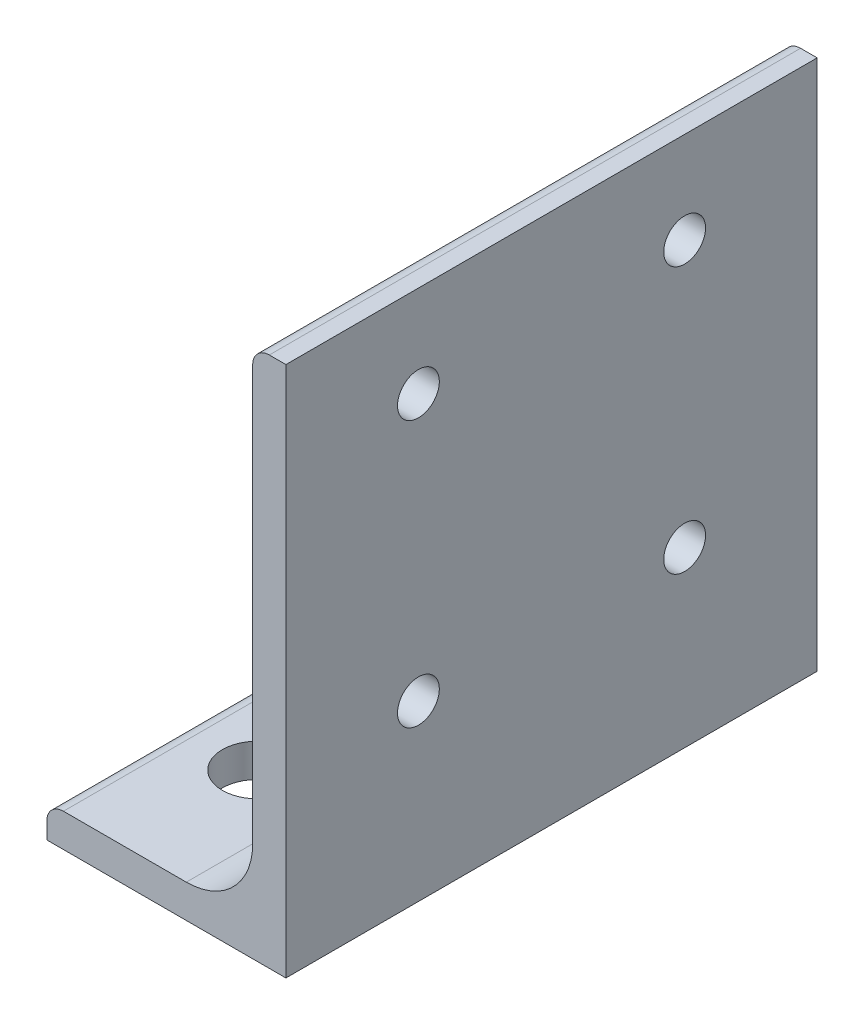
from build123d import *

# Parameters (mm, degrees)
BOSS_EXTRUDE1_DEPTH = 25.4
SKETCH3_W           = 27.94
SKETCH3_H           = 13.830872484
CUT_EXTRUDE1_DEPTH  = 77.2
FILLET1_R           = 1.5875
SKETCH4_R           = 3.3782
CUT_EXTRUDE2_DEPTH  = 60.652834174
SKETCH5_R           = 2.000000064
CUT_EXTRUDE3_DEPTH  = 62.224011629


with BuildPart() as part:
    # Sketch2 → Boss-Extrude1 (new, symmetric)
    with BuildSketch(Plane.XY):
        with BuildLine():
            Line((-25.4, 0), (25.4, 0))
            Line((25.4, 0), (25.4, 50.8))
            Line((25.4, 50.8), (23.8125, 50.8))
            ThreePointArc((23.8125, 50.8), (22.689967985, 50.335032015), (22.225, 49.2125))
            Line((22.225, 49.2125), (22.225, 9.525))
            ThreePointArc((22.225, 9.525), (20.365128061, 5.034871939), (15.875, 3.175))
            Line((15.875, 3.175), (-23.8125, 3.175))
            ThreePointArc((-23.8125, 3.175), (-24.935032015, 2.710032015), (-25.4, 1.5875))
            Line((-25.4, 1.5875), (-25.4, 0))
        make_face()
    extrude(amount=BOSS_EXTRUDE1_DEPTH, both=True)

    # Sketch3 → Cut-Extrude1 (cut, through all)
    with BuildSketch(Plane(origin=(0, 0, -25.4), x_dir=(-1, 0, 0), z_dir=(0, 0, -1))):
        with Locations((11.43, 1.484116331)):
            Rectangle(SKETCH3_W, SKETCH3_H)
    extrude(amount=-CUT_EXTRUDE1_DEPTH, mode=Mode.SUBTRACT)

    # Fillet1
    fillet1_edges = [part.edges().sort_by_distance(p)[0] for p in [
        (2.54, 3.175, 0),
    ]]
    fillet(fillet1_edges, radius=FILLET1_R)

    # Sketch4 → Cut-Extrude2 (cut, through all)
    with BuildSketch(Plane(origin=(0, 3.175, 0), x_dir=(1, 0, 0), z_dir=(0, 1, 0))):
        with Locations((10.00125, 12.7)):
            Circle(SKETCH4_R)
        with Locations((10.00125, -12.7)):
            Circle(SKETCH4_R)
    extrude(amount=-CUT_EXTRUDE2_DEPTH, mode=Mode.SUBTRACT)

    # Sketch5 → Cut-Extrude3 (cut, through all)
    with BuildSketch(Plane(origin=(25.4, 0, 0), x_dir=(0, 0, -1), z_dir=(1, 0, 0))):
        with Locations((12.72792202, 16.6)):
            Circle(SKETCH5_R)
        with Locations((-12.72792202, 16.6)):
            Circle(SKETCH5_R)
        with Locations((-12.72792202, 42.055844039)):
            Circle(SKETCH5_R)
        with Locations((12.72792202, 42.055844039)):
            Circle(SKETCH5_R)
    extrude(amount=-CUT_EXTRUDE3_DEPTH, mode=Mode.SUBTRACT)


solid = part.part
